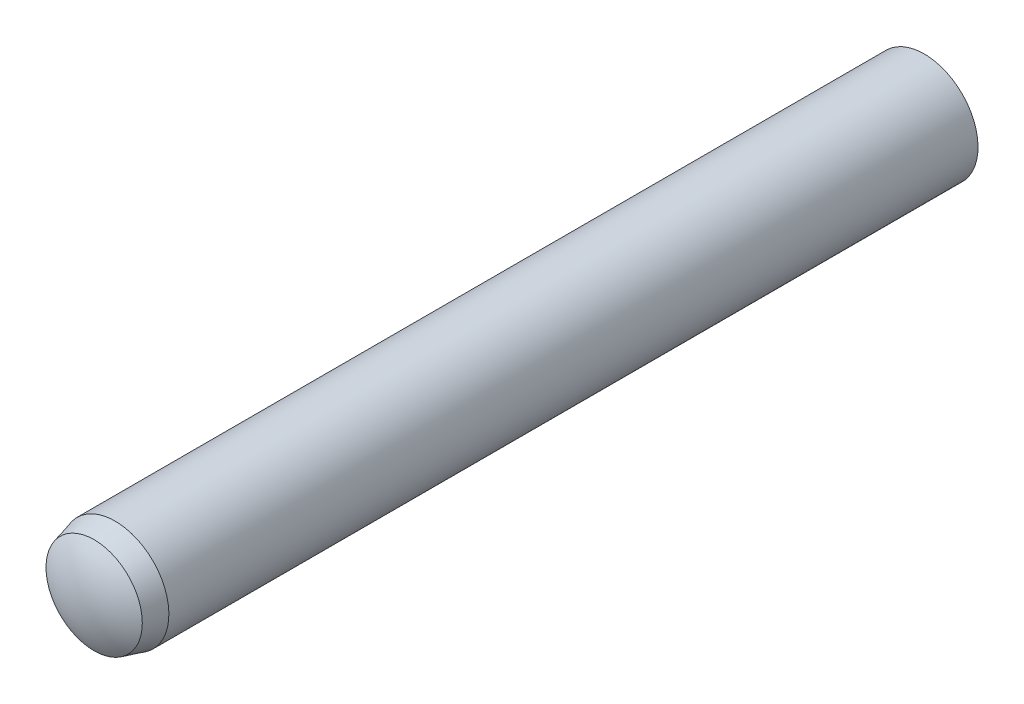
from build123d import *


with BuildPart() as part:
    # Sketch3 → Revolve1 (revolve)
    with BuildSketch(Plane(origin=(0, 0, 0), x_dir=(0, 0, -1), z_dir=(1, 0, 0))):
        with BuildLine():
            Line((-8, 0), (8, 0))
            ThreePointArc((8, 0), (7.923384418, 0.522015325), (7.7, 1))
            Line((7.7, 1), (-7.35, 1))
            Line((-7.35, 1), (-7.74, 0.895499815))
            ThreePointArc((-7.74, 0.895499815), (-7.933685026, 0.46624026), (-8, 0))
        make_face()
    revolve(axis=Axis((0, 0, 8), (0, 0, -1)))


solid = part.part
